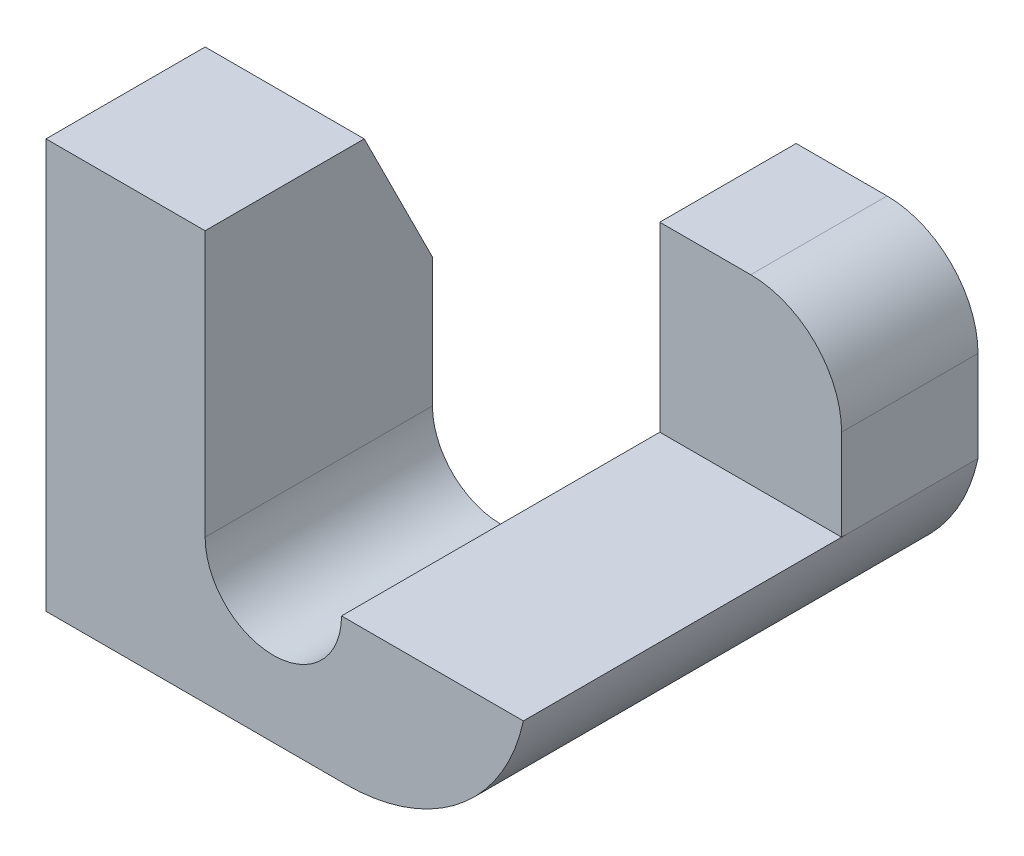
from build123d import *

# Parameters (mm, degrees)
Y_KSEKLIK_EKSTR_ZYON1_DEPTH = 40
Y_KSEKLIK_EKSTR_ZYON2_DEPTH = 40
IZIM9_W                     = 32
IZIM9_H                     = 24
Y_KSEKLIK_EKSTR_ZYON3_DEPTH = 32
RADYUS1_R                   = 16
KES_EKSTR_ZYON6_DEPTH       = 32


with BuildPart() as part:
    # Çizim1 → Yükseklik-Ekstrüzyon1 (new body)
    with BuildSketch(Plane.XY):
        with BuildLine():
            Line((0, 0), (0, 72))
            Line((0, 72), (28, 72))
            Line((28, 72), (28, 25.300439713))
            ThreePointArc((28, 25.300439713), (40, 13.300439713), (52, 25.300439713))
            Line((52, 25.300439713), (84, 25.300439713))
            ThreePointArc((84, 25.300439713), (72.828989381, 7.116411742), (52.709172399, 0))
            Line((52.709172399, 0), (0, 0))
        make_face()
    extrude(amount=-Y_KSEKLIK_EKSTR_ZYON1_DEPTH)

    # Çizim8 → Yükseklik-Ekstrüzyon2 (add)
    with BuildSketch(Plane(origin=(0, 0, -40), x_dir=(-1, 0, 0), z_dir=(0, 0, -1))):
        with BuildLine():
            Line((-52, 25.300439713), (-52, 0))
            Line((-52, 0), (-52.709172399, 0))
            ThreePointArc((-52.709172399, 0), (-72.828989381, 7.116411742), (-84, 25.300439713))
            Line((-84, 25.300439713), (-52, 25.300439713))
        make_face()
    extrude(amount=Y_KSEKLIK_EKSTR_ZYON2_DEPTH)

    # Çizim9 → Yükseklik-Ekstrüzyon3 (add)
    with BuildSketch(Plane(origin=(0, 25.300439713, 0), x_dir=(1, 0, 0), z_dir=(0, 1, 0))):
        with Locations((68, 68)):
            Rectangle(IZIM9_W, IZIM9_H)
    extrude(amount=Y_KSEKLIK_EKSTR_ZYON3_DEPTH)

    # Radyus1
    radyus1_edges = [part.edges().sort_by_distance(p)[0] for p in [
        (84, 57.300439713, -68),
    ]]
    fillet(radyus1_edges, radius=RADYUS1_R)

    # Çizim10 → Kes-Ekstrüzyon6 (cut)
    with BuildSketch(Plane(origin=(28, 0, 0), x_dir=(0, 0, -1), z_dir=(1, 0, 0))):
        Polygon((40, 72), (28, 72), (40, 48), align=None)
    extrude(amount=-KES_EKSTR_ZYON6_DEPTH, mode=Mode.SUBTRACT)


solid = part.part
